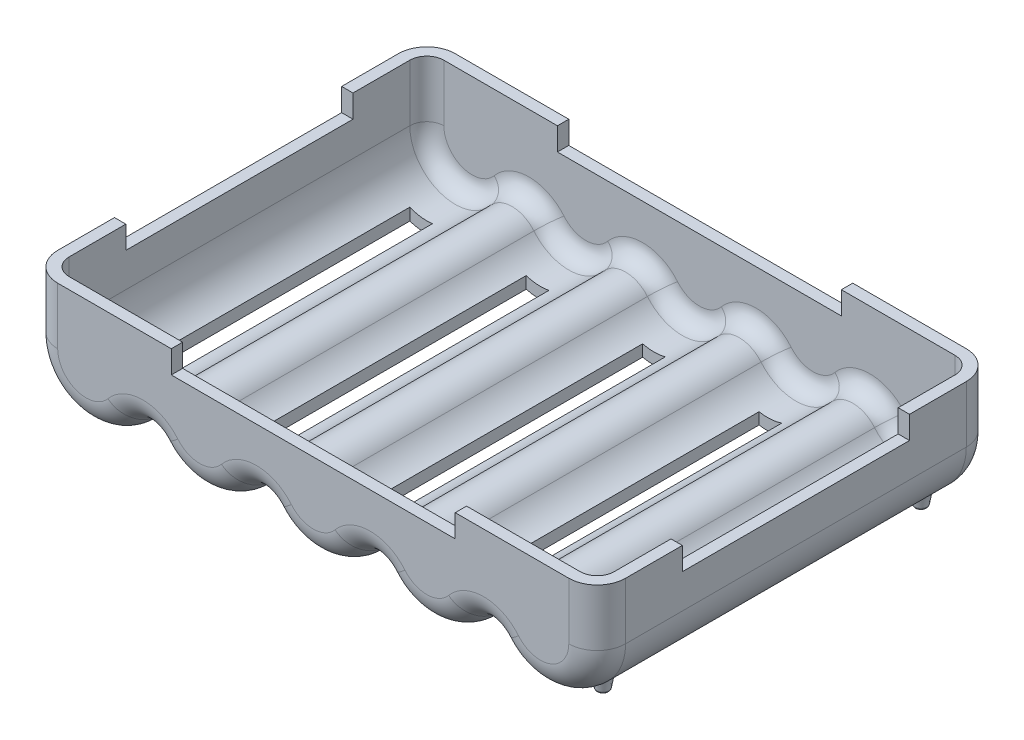
from build123d import *

# Parameters (mm, degrees)
BOSS_EXTRUDE1_DEPTH       = 17.5
SKETCH3_W                 = 50
SKETCH3_H                 = 20
CUT_EXTRUDE1_DEPTH        = 35
FILLET1_R                 = 2.5
SHELL1_T                  = -1
SKETCH4_W                 = 2
SKETCH4_H                 = 25
CUT_EXTRUDE2_DEPTH        = 35
BOSS_EXTRUDE3_OUTLINE_R   = 0.5
BOSS_EXTRUDE3_DEPTH       = 1.311938361
BOSS_EXTRUDE3_DRAFT       = -10
BOSS_EXTRUDE3_2_OUTLINE_R = 0.5
BOSS_EXTRUDE3_2_DEPTH     = 1.31193833
BOSS_EXTRUDE3_2_DRAFT     = -10
BOSS_EXTRUDE3_3_OUTLINE_R = 0.5
BOSS_EXTRUDE3_3_DEPTH     = 1.311938335
BOSS_EXTRUDE3_3_DRAFT     = -10
BOSS_EXTRUDE3_4_OUTLINE_R = 0.5
BOSS_EXTRUDE3_4_DEPTH     = 1.311938319
BOSS_EXTRUDE3_4_DRAFT     = -10
FILLET3_R                 = 0.25


# Read off the part's stored shape, not the designer's step: Boss-Extrude3
with BuildPart() as part:
    # Sketch1 → Boss-Extrude1 (new, symmetric)
    with BuildSketch(Plane.XY):
        with BuildLine():
            Line((-25, 2.5), (-12.5, 2.5))
            Line((-12.5, 2.5), (-12.5, 0.5))
            Line((-12.5, 0.5), (12.5, 0.5))
            Line((12.5, 0.5), (12.5, 2.5))
            Line((12.5, 2.5), (25, 2.5))
            Line((25, 2.5), (25, -2.5))
            ThreePointArc((25, -2.5), (21.698415551, -7.202699716), (16.153846154, -5.694855332))
            ThreePointArc((16.153846154, -5.694855332), (15, -5.153311931), (13.846153846, -5.694855332))
            ThreePointArc((13.846153846, -5.694855332), (10, -7.5), (6.153846154, -5.694855332))
            ThreePointArc((6.153846154, -5.694855332), (5, -5.153311931), (3.846153846, -5.694855332))
            ThreePointArc((3.846153846, -5.694855332), (0, -7.5), (-3.846153846, -5.694855332))
            ThreePointArc((-3.846153846, -5.694855332), (-5, -5.153311931), (-6.153846154, -5.694855332))
            ThreePointArc((-6.153846154, -5.694855332), (-10, -7.5), (-13.846153846, -5.694855332))
            ThreePointArc((-13.846153846, -5.694855332), (-15, -5.153311931), (-16.153846154, -5.694855332))
            ThreePointArc((-16.153846154, -5.694855332), (-21.698415551, -7.202699716), (-25, -2.5))
            Line((-25, -2.5), (-25, 2.5))
        make_face()
    extrude(amount=BOSS_EXTRUDE1_DEPTH, both=True)

    # Sketch3 → Cut-Extrude1 (cut)
    with BuildSketch(Plane(origin=(0, 0.5, 0), x_dir=(1, 0, 0), z_dir=(0, 1, 0))):
        Rectangle(SKETCH3_W, SKETCH3_H)
    extrude(amount=CUT_EXTRUDE1_DEPTH, mode=Mode.SUBTRACT)

    # Fillet1
    fillet1_edges = [part.edges().sort_by_distance(p)[0] for p in [
        (15, -5.153311931, -17.5),
        (10, -7.5, -17.5),
        (5, -5.153311931, -17.5),
        (0, -7.5, -17.5),
        (-5, -5.153311931, -17.5),
        (-10, -7.5, -17.5),
        (-15, -5.153311931, -17.5),
        (-21.698415551, -7.202699716, -17.5),
        (-25, 0, -17.5),
        (25, 0, -17.5),
        (21.698415551, -7.202699716, -17.5),
        (-25, 0, 17.5),
        (-21.698415551, -7.202699716, 17.5),
        (-15, -5.153311931, 17.5),
        (-10, -7.5, 17.5),
        (-5, -5.153311931, 17.5),
        (21.698415551, -7.202699716, 17.5),
        (0, -7.5, 17.5),
        (5, -5.153311931, 17.5),
        (10, -7.5, 17.5),
        (15, -5.153311931, 17.5),
        (25, 0, 17.5),
    ]]
    fillet(fillet1_edges, radius=FILLET1_R)

    # Shell1
    shell1_openings = [part.faces().sort_by_distance(p)[0] for p in [
        (0, 0.5, 0),
        (-18.667389877, 2.5, 13.703675988),
        (-18.667389877, 2.5, -13.703675988),
        (-12.5, 1.5, 13.75),
        (-12.5, 1.5, -13.75),
        (12.5, 1.5, 13.75),
        (12.5, 1.5, -13.75),
        (18.667389877, 2.5, 13.703675988),
        (18.667389877, 2.5, -13.703675988),
        (18.75, 1.5, -10),
        (-18.75, 1.5, -10),
        (18.75, 1.5, 10),
        (-18.75, 1.5, 10),
    ]]
    offset(amount=SHELL1_T, openings=shell1_openings, kind=Kind.INTERSECTION)

    # Sketch4 → Cut-Extrude2 (cut)
    with BuildSketch(Plane(origin=(0, 2.5, 0), x_dir=(1, 0, 0), z_dir=(0, 1, 0))):
        with Locations((-20.5, 0)):
            Rectangle(SKETCH4_W, SKETCH4_H)
        with Locations((-10.25, 0)):
            Rectangle(SKETCH4_W, SKETCH4_H)
        Rectangle(SKETCH4_W, SKETCH4_H)
        with Locations((10.25, 0)):
            Rectangle(SKETCH4_W, SKETCH4_H)
        with Locations((20.5, 0)):
            Rectangle(SKETCH4_W, SKETCH4_H)
    extrude(amount=-CUT_EXTRUDE2_DEPTH, mode=Mode.SUBTRACT)


with BuildPart() as boss_extrude3_tool:
    # Boss-Extrude3 outline → Boss-Extrude3 (with draft: the straight prism first)
    with BuildSketch(Plane(origin=(0, -8, 0), x_dir=(1, 0, 0), z_dir=(0, 1, 0))):
        with Locations((22, -14)):
            Circle(BOSS_EXTRUDE3_OUTLINE_R)
    extrude(amount=BOSS_EXTRUDE3_DEPTH)
    # Boss-Extrude3: the draft: its side faces are tilted about the plane it starts from
    boss_extrude3_sides = [boss_extrude3_tool.faces().sort_by_distance(p)[0] for p in [
        (21.5, -7.34403082, 14),
    ]]
    draft(boss_extrude3_sides, Plane(origin=(0, -8, 0), x_dir=(1, 0, 0), z_dir=(0, 1, 0)), BOSS_EXTRUDE3_DRAFT)


with BuildPart() as part_1:
    add(part.part)

    # Boss-Extrude3: add boss_extrude3_tool
    add(boss_extrude3_tool.part)


with BuildPart() as boss_extrude3_2_tool:
    # Boss-Extrude3 2 outline → Boss-Extrude3 2 (with draft: the straight prism first)
    with BuildSketch(Plane(origin=(0, -8, 0), x_dir=(1, 0, 0), z_dir=(0, 1, 0))):
        with Locations((22, 14)):
            Circle(BOSS_EXTRUDE3_2_OUTLINE_R)
    extrude(amount=BOSS_EXTRUDE3_2_DEPTH)
    # Boss-Extrude3 2: the draft: its side faces are tilted about the plane it starts from
    boss_extrude3_2_sides = [boss_extrude3_2_tool.faces().sort_by_distance(p)[0] for p in [
        (21.5, -7.344030835, -14),
    ]]
    draft(boss_extrude3_2_sides, Plane(origin=(0, -8, 0), x_dir=(1, 0, 0), z_dir=(0, 1, 0)), BOSS_EXTRUDE3_2_DRAFT)


with BuildPart() as part_2:
    add(part_1.part)

    # Boss-Extrude3 2: add boss_extrude3_2_tool
    add(boss_extrude3_2_tool.part)


with BuildPart() as boss_extrude3_3_tool:
    # Boss-Extrude3 3 outline → Boss-Extrude3 3 (with draft: the straight prism first)
    with BuildSketch(Plane(origin=(0, -8, 0), x_dir=(1, 0, 0), z_dir=(0, 1, 0))):
        with Locations((-22, 14)):
            Circle(BOSS_EXTRUDE3_3_OUTLINE_R)
    extrude(amount=BOSS_EXTRUDE3_3_DEPTH)
    # Boss-Extrude3 3: the draft: its side faces are tilted about the plane it starts from
    boss_extrude3_3_sides = [boss_extrude3_3_tool.faces().sort_by_distance(p)[0] for p in [
        (-22.5, -7.344030832, -14),
    ]]
    draft(boss_extrude3_3_sides, Plane(origin=(0, -8, 0), x_dir=(1, 0, 0), z_dir=(0, 1, 0)), BOSS_EXTRUDE3_3_DRAFT)


with BuildPart() as part_3:
    add(part_2.part)

    # Boss-Extrude3 3: add boss_extrude3_3_tool
    add(boss_extrude3_3_tool.part)


with BuildPart() as boss_extrude3_4_tool:
    # Boss-Extrude3 4 outline → Boss-Extrude3 4 (with draft: the straight prism first)
    with BuildSketch(Plane(origin=(0, -8, 0), x_dir=(1, 0, 0), z_dir=(0, 1, 0))):
        with Locations((-22, -14)):
            Circle(BOSS_EXTRUDE3_4_OUTLINE_R)
    extrude(amount=BOSS_EXTRUDE3_4_DEPTH)
    # Boss-Extrude3 4: the draft: its side faces are tilted about the plane it starts from
    boss_extrude3_4_sides = [boss_extrude3_4_tool.faces().sort_by_distance(p)[0] for p in [
        (-22.5, -7.344030841, 14),
    ]]
    draft(boss_extrude3_4_sides, Plane(origin=(0, -8, 0), x_dir=(1, 0, 0), z_dir=(0, 1, 0)), BOSS_EXTRUDE3_4_DRAFT)


with BuildPart() as part_4:
    add(part_3.part)

    # Boss-Extrude3 4: add boss_extrude3_4_tool
    add(boss_extrude3_4_tool.part)

    # Fillet3
    fillet3_edges = [part_4.edges().sort_by_distance(p)[0] for p in [
        (21.5, -8, 14),
        (21.5, -8, -14),
        (-22.5, -8, -14),
        (-22.5, -8, 14),
    ]]
    fillet(fillet3_edges, radius=FILLET3_R)


solid = part_4.part
